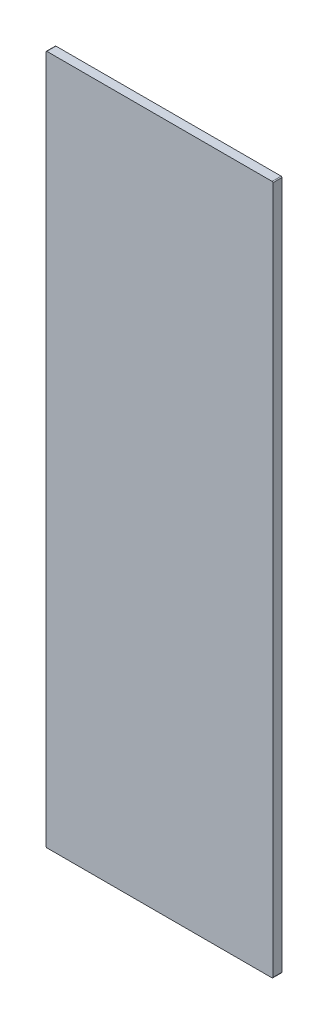
from build123d import *

# Parameters (mm, degrees)
BOSS_EXTRUDE1_DEPTH = 10


with BuildPart() as part:
    # Sketch1 → Boss-Extrude1 (new body)
    with BuildSketch(Plane.XY):
        with BuildLine():
            Line((204, 0), (-44, 0))
            ThreePointArc((-44, 0), (-44.707106781, -0.292893219), (-45, -1))
            Line((-45, -1), (-45, -759))
            ThreePointArc((-45, -759), (-44.707106781, -759.707106781), (-44, -760))
            Line((-44, -760), (204, -760))
            ThreePointArc((204, -760), (204.707106781, -759.707106781), (205, -759))
            Line((205, -759), (205, -1))
            ThreePointArc((205, -1), (204.707106781, -0.292893219), (204, 0))
        make_face()
    extrude(amount=BOSS_EXTRUDE1_DEPTH)


solid = part.part
